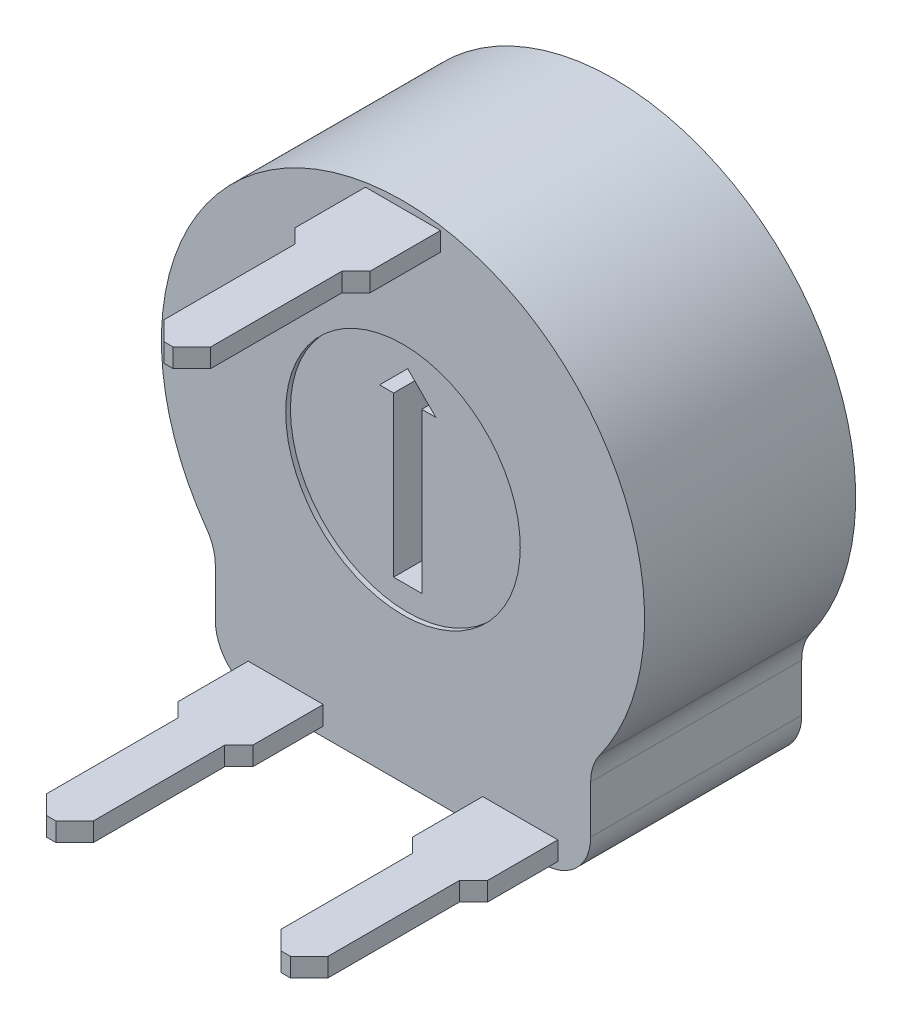
from build123d import *

# Parameters (mm, degrees)
BOSS_EXTRU_1_DEPTH      = 4.5
ESQUISSE4_R             = 2.5
ENL_V_MAT_EXTRU_1_DEPTH = 0.1
ENL_V_START             = -0.1
ESQUISSE5_R             = 2.5
ENL_V_MAT_EXTRU_2_DEPTH = 0.1
ENL_V_MAT_EXTRU_3_DEPTH = 9.788771245
CONG_1_R                = 1
ESQUISSE7_W             = 1.6
ESQUISSE7_H             = 0.4
BOSS_EXTRU_4_DEPTH      = 1.5
ESQUISSE8_W             = 1
ESQUISSE8_H             = 0.4
BOSS_EXTRU_5_DEPTH      = 3.5
CHANFREIN3_SIZE         = 0.3
CHANFREIN4_SIZE         = 0.4


with BuildPart() as part:
    # Esquisse1 → Boss.-Extru.1 (new body)
    with BuildSketch(Plane.XY):
        with BuildLine():
            Line((-4, -3.243840317), (-4, -5.6))
            Line((-4, -5.6), (4, -5.6))
            Line((4, -5.6), (4, -3.243840317))
            ThreePointArc((4, -3.243840317), (0, 5.15), (-4, -3.243840317))
        make_face()
    extrude(amount=BOSS_EXTRU_1_DEPTH)

    # Esquisse4 → Enlèv. mat.-Extru.1 (cut)
    with BuildSketch(Plane(origin=(0, 0, 0), x_dir=(-1, 0, 0), z_dir=(0, 0, -1))):
        Circle(ESQUISSE4_R)
    extrude(amount=-ENL_V_MAT_EXTRU_1_DEPTH, mode=Mode.SUBTRACT)

    # Esquisse5 → Enlèv. mat.-Extru.2 (cut)
    with BuildSketch(Plane.XY.offset(4.5).offset(ENL_V_START)):
        with Locations(Location((0, 0, 0), (0, 0, 180))):
            Circle(ESQUISSE5_R)
    extrude(amount=ENL_V_MAT_EXTRU_2_DEPTH, mode=Mode.SUBTRACT)

    # Esquisse6 → Enlèv. mat.-Extru.3 (cut, through all)
    with BuildSketch(Plane(origin=(0, 0, 0.1), x_dir=(-1, 0, 0), z_dir=(0, 0, -1))):
        Polygon((0, 2), (-0.6, 1.4), (-0.3, 1.4), (-0.3, -2), (0.3, -2), (0.3, 1.4), (0.6, 1.4), align=None)
    extrude(amount=-ENL_V_MAT_EXTRU_3_DEPTH, mode=Mode.SUBTRACT)

    # Congé1
    cong_1_edges = [part.edges().sort_by_distance(p)[0] for p in [
        (4, -3.243840317, 2.25),
        (4, -5.6, 2.25),
        (-4, -5.6, 2.25),
        (-4, -3.243840317, 2.25),
    ]]
    fillet(cong_1_edges, radius=CONG_1_R)

    # Esquisse7 → Boss.-Extru.4 (add)
    with BuildSketch(Plane.XY.offset(4.5)):
        with Locations((-2.5, -5.2)):
            Rectangle(ESQUISSE7_W, ESQUISSE7_H)
        with Locations((2.5, -5.2)):
            Rectangle(ESQUISSE7_W, ESQUISSE7_H)
        with Locations((0, 4.8)):
            Rectangle(ESQUISSE7_W, ESQUISSE7_H)
    extrude(amount=BOSS_EXTRU_4_DEPTH)

    # Esquisse8 → Boss.-Extru.5 (add)
    with BuildSketch(Plane.XY.offset(6)):
        with Locations((0, 4.8)):
            Rectangle(ESQUISSE8_W, ESQUISSE8_H)
        with Locations((-2.5, -5.2)):
            Rectangle(ESQUISSE8_W, ESQUISSE8_H)
        with Locations((2.5, -5.2)):
            Rectangle(ESQUISSE8_W, ESQUISSE8_H)
    extrude(amount=BOSS_EXTRU_5_DEPTH)

    # Chanfrein3
    chanfrein3_edges = [part.edges().sort_by_distance(p)[0] for p in [
        (0.5, 4.8, 6),
        (-2, -5.2, 6),
        (3, -5.2, 6),
        (2, -5.2, 6),
        (-3, -5.2, 6),
        (-0.5, 4.8, 6),
    ]]
    chamfer(chanfrein3_edges, length=CHANFREIN3_SIZE - 0.0001)  # a hair under: the kernel refuses the full size

    # Chanfrein4
    chanfrein4_edges = [part.edges().sort_by_distance(p)[0] for p in [
        (-0.5, 4.8, 9.5),
        (0.5, 4.8, 9.5),
        (-3, -5.2, 9.5),
        (-2, -5.2, 9.5),
        (2, -5.2, 9.5),
        (3, -5.2, 9.5),
    ]]
    chamfer(chanfrein4_edges, length=CHANFREIN4_SIZE)


solid = part.part
